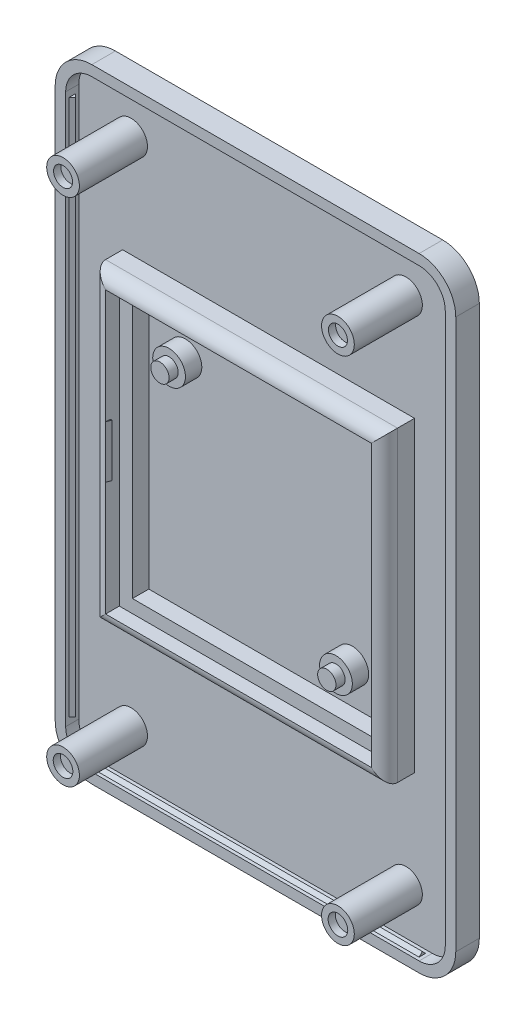
from build123d import *

# Parameters (mm, degrees)
ESQUISSE2_W              = 58
ESQUISSE2_H              = 92
BOSS_EXTRU_1_DEPTH       = 1.6
CONG_1_R                 = 4
ESQUISSE3_W              = 40.6
ESQUISSE3_H              = 42.9
ESQUISSE3_W_2            = 36.6
ESQUISSE3_H_2            = 38.9
EXTRU_MINCE1_DEPTH       = 2.5
ESQUISSE4_R              = 2.5
BOSS_EXTRU_2_DEPTH       = 2.5
ESQUISSE5_R              = 1.4
BOSS_EXTRU_3_DEPTH       = 3.9
ESQUISSE6_R              = 2.5
BOSS_EXTRU_4_DEPTH       = 2.5
ESQUISSE7_R              = 1.4
BOSS_EXTRU_5_DEPTH       = 3.9
ESQUISSE8_W              = 44.6
ESQUISSE8_H              = 46.9
ESQUISSE8_W_2            = 40.6
ESQUISSE8_H_2            = 42.9
EXTRU_MINCE2_DEPTH       = 4.6
CONG_2_R                 = 2
ESQUISSE10_R             = 2.5
BOSS_EXTRU_6_DEPTH       = 10.4
ESQUISSE13_R             = 1.5
ESQUISSE13_R_2           = 1.45
ENL_V_MAT_EXTRU_1_DEPTH  = 1.1
EXTRU_MINCE3_DEPTH       = 2
EXTRU_MINCE3_DEPTH_BACK  = 1.6
BOSS_EXTRU_9_DEPTH       = 4
BOSS_EXTRU_9_DEPTH_BACK  = 4
BOSS_EXTRU_10_DEPTH      = 4
BOSS_EXTRU_10_DEPTH_BACK = 4
BOSS_EXTRU_11_DEPTH      = 41
BOSS_EXTRU_12_DEPTH      = 24.5
ENL_V_MAT_EXTRU_4_DEPTH  = 0.6


with BuildPart() as part:
    # Esquisse2 → Boss.-Extru.1 (new body)
    with BuildSketch(Plane.XY):
        Rectangle(ESQUISSE2_W, ESQUISSE2_H)
    extrude(amount=-BOSS_EXTRU_1_DEPTH)

    # Congé1
    cong_1_edges = [part.edges().sort_by_distance(p)[0] for p in [
        (29, -46, -0.8),
        (-29, -46, -0.8),
        (-29, 46, -0.8),
        (29, 46, -0.8),
    ]]
    fillet(cong_1_edges, radius=CONG_1_R)

    # Esquisse3 → Extru.-Mince1 (add)
    with BuildSketch(Plane.XY):
        Rectangle(ESQUISSE3_W, ESQUISSE3_H)
        Rectangle(ESQUISSE3_W_2, ESQUISSE3_H_2, mode=Mode.SUBTRACT)
    extrude(amount=EXTRU_MINCE1_DEPTH)

    # Esquisse4 → Boss.-Extru.2 (add)
    with BuildSketch(Plane.XY):
        with Locations(Location((-12.7, 13.95, 0), (0, 0, 180))):
            Circle(ESQUISSE4_R)
    extrude(amount=BOSS_EXTRU_2_DEPTH)

    # Esquisse5 → Boss.-Extru.3 (add)
    with BuildSketch(Plane.XY):
        with Locations((-12.7, 13.95)):
            Circle(ESQUISSE5_R)
    extrude(amount=BOSS_EXTRU_3_DEPTH)

    # Esquisse6 → Boss.-Extru.4 (add)
    with BuildSketch(Plane.XY):
        with Locations(Location((12.8, -13.95, 0), (0, 0, 180))):
            Circle(ESQUISSE6_R)
    extrude(amount=BOSS_EXTRU_4_DEPTH)

    # Esquisse7 → Boss.-Extru.5 (add)
    with BuildSketch(Plane.XY):
        with Locations((12.8, -13.95)):
            Circle(ESQUISSE7_R)
    extrude(amount=BOSS_EXTRU_5_DEPTH)

    # Esquisse8 → Extru.-Mince2 (add)
    with BuildSketch(Plane.XY):
        Rectangle(ESQUISSE8_W, ESQUISSE8_H)
        Rectangle(ESQUISSE8_W_2, ESQUISSE8_H_2, mode=Mode.SUBTRACT)
    extrude(amount=EXTRU_MINCE2_DEPTH)

    # Congé2
    cong_2_edges = [part.edges().sort_by_distance(p)[0] for p in [
        (22.3, 0, 4.6),
        (0, 23.45, 4.6),
        (-22.3, 0, 4.6),
        (0, -23.45, 4.6),
    ]]
    fillet(cong_2_edges, radius=CONG_2_R - 0.0001)  # a hair under: the kernel refuses the full size

    # Esquisse10 → Boss.-Extru.6 (add)
    with BuildSketch(Plane.XY):
        with Locations(Location((21, -39, 0), (0, 0, 180))):
            Circle(ESQUISSE10_R)
        with Locations(Location((-21, -39, 0), (0, 0, 180))):
            Circle(ESQUISSE10_R)
        with Locations(Location((-21, 39, 0), (0, 0, 180))):
            Circle(ESQUISSE10_R)
        with Locations(Location((21, 39, 0), (0, 0, 180))):
            Circle(ESQUISSE10_R)
    extrude(amount=BOSS_EXTRU_6_DEPTH)

    # Esquisse13 → Enlèv. mat.-Extru.1 (cut)
    with BuildSketch(Plane.XY.offset(10.4)):
        with Locations((21, -39)):
            Circle(ESQUISSE13_R)
        with Locations((-21, -39)):
            Circle(ESQUISSE13_R)
        with Locations((-21, 39)):
            Circle(ESQUISSE13_R_2)
        with Locations((21, 39)):
            Circle(ESQUISSE13_R_2)
    extrude(amount=-ENL_V_MAT_EXTRU_1_DEPTH, mode=Mode.SUBTRACT)

    # Esquisse14 → Extru.-Mince3 (add, two sides: drawn at the far end of the back side and taken through both)
    with BuildSketch(Plane.XY.offset(-EXTRU_MINCE3_DEPTH_BACK)):
        with BuildLine():
            Line((-25, -47.6), (25, -47.6))
            ThreePointArc((25, -47.6), (28.959797975, -45.959797975), (30.6, -42))
            Line((30.6, -42), (30.6, 42))
            ThreePointArc((30.6, 42), (28.959797975, 45.959797975), (25, 47.6))
            Line((25, 47.6), (-25, 47.6))
            ThreePointArc((-25, 47.6), (-28.959797975, 45.959797975), (-30.6, 42))
            Line((-30.6, 42), (-30.6, -42))
            ThreePointArc((-30.6, -42), (-28.959797975, -45.959797975), (-25, -47.6))
        make_face()
        with BuildLine():
            Line((-25, -46), (25, -46))
            ThreePointArc((25, -46), (27.828427125, -44.828427125), (29, -42))
            Line((29, -42), (29, 42))
            ThreePointArc((29, 42), (27.828427125, 44.828427125), (25, 46))
            Line((25, 46), (-25, 46))
            ThreePointArc((-25, 46), (-27.828427125, 44.828427125), (-29, 42))
            Line((-29, 42), (-29, -42))
            ThreePointArc((-29, -42), (-27.828427125, -44.828427125), (-25, -46))
        make_face(mode=Mode.SUBTRACT)
    extrude(amount=EXTRU_MINCE3_DEPTH + EXTRU_MINCE3_DEPTH_BACK)

    # Esquisse3D7 → Boss.-Extru.9 (add, two sides: drawn at the far end of the back side and taken through both)
    with BuildSketch(Plane(origin=(20.3, 0, 4.6), x_dir=(-0.33633639699815254, -1.1714474630458867e-14, -0.9417419115948389), z_dir=(0, -1, 0)).offset(-BOSS_EXTRU_9_DEPTH_BACK)):
        Polygon((0, 0), (0.659219338, 0.235435478), (0.743303437, 0), align=None)
    extrude(amount=BOSS_EXTRU_9_DEPTH + BOSS_EXTRU_9_DEPTH_BACK)

    # Esquisse3D9 → Boss.-Extru.11 (add, symmetric)
    with BuildSketch(Plane(origin=(29, 0, 1), x_dir=(0, 0, -1), z_dir=(0, 1, 0))):
        Polygon((0, 0), (-0.5, 0), (0, 0.5), (0.5, 0), align=None)
    boss_extru_11 = extrude(amount=BOSS_EXTRU_11_DEPTH, both=True)

    # Symétrie1: Boss.-Extru.11 across plane
    add(boss_extru_11.mirror(Plane(origin=(0, 0, 0), x_dir=(0, 0, 1), z_dir=(1, 0, 0))))

    # Esquisse3D12 → Boss.-Extru.12 (add, symmetric)
    with BuildSketch(Plane(origin=(0, 46, 1.5), x_dir=(0, 0, -1), z_dir=(-1, 0, 0))):
        Polygon((0, 0), (0.5, 0.5), (1, 0), align=None)
    boss_extru_12 = extrude(amount=BOSS_EXTRU_12_DEPTH, both=True)

    # Symétrie2: Boss.-Extru.12 across plane
    add(boss_extru_12.mirror(Plane.ZX))

    # Esquisse31 → Enlèv. mat.-Extru.4 (cut)
    with BuildSketch(Plane(origin=(0, 0, -1.6), x_dir=(-1, 0, 0), z_dir=(0, 0, -1))):
        with BuildLine():
            add(Edge.make_bspline(
                [(4.349206349, -9.988662132), (3.968253968, -9.83446712), (3.696145125, -9.489795918), (3.632653061, -9.081632653)],
                knots=[0, 0, 0, 0, 1, 1, 1, 1], degree=3))
            add(Edge.make_bspline(
                [(3.632653061, -9.081632653), (3.587301587, -8.845804989), (3.632653061, -8.682539683), (3.995464853, -8.029478458)],
                knots=[1, 1, 1, 1, 2, 2, 2, 2], degree=3))
            add(Edge.make_bspline(
                [(3.995464853, -8.029478458), (5.35600907, -5.580498866), (6.054421769, -2.814058957), (6.01814059, -0.011337868)],
                knots=[2, 2, 2, 2, 3, 3, 3, 3], degree=3))
            add(Edge.make_bspline(
                [(6.01814059, -0.011337868), (6.054421769, 2.709750567), (5.392290249, 5.367346939), (4.0861678, 7.752834467)],
                knots=[3, 3, 3, 3, 4, 4, 4, 4], degree=3))
            add(Edge.make_bspline(
                [(4.0861678, 7.752834467), (3.89569161, 8.151927438), (3.723356009, 8.532879819), (3.578231293, 8.941043084)],
                knots=[4, 4, 4, 4, 5, 5, 5, 5], degree=3))
            add(Edge.make_bspline(
                [(3.578231293, 8.941043084), (3.632653061, 9.285714286), (3.804988662, 9.603174603), (4.0861678, 9.793650794)],
                knots=[5, 5, 5, 5, 6, 6, 6, 6], degree=3))
            add(Edge.make_bspline(
                [(4.0861678, 9.793650794), (4.494331066, 10.011337868), (4.993197279, 9.965986395), (5.365079365, 9.712018141)],
                knots=[6, 6, 6, 6, 7, 7, 7, 7], degree=3))
            add(Edge.make_bspline(
                [(5.365079365, 9.712018141), (5.619047619, 9.385487528), (5.836734694, 9.058956916), (6.01814059, 8.678004535)],
                knots=[7, 7, 7, 7, 8, 8, 8, 8], degree=3))
            add(Edge.make_bspline(
                [(6.01814059, 8.678004535), (6.997732426, 6.79138322), (7.659863946, 4.795918367), (7.986394558, 2.709750567)],
                knots=[8, 8, 8, 8, 9, 9, 9, 9], degree=3))
            add(Edge.make_bspline(
                [(7.986394558, 2.709750567), (8.195011338, 1.068027211), (8.222222222, -0.600907029), (8.068027211, -2.25170068)],
                knots=[9, 9, 9, 9, 10, 10, 10, 10], degree=3))
            add(Edge.make_bspline(
                [(8.068027211, -2.25170068), (7.786848073, -4.37414966), (7.160997732, -6.424036281), (6.199546485, -8.337868481)],
                knots=[10, 10, 10, 10, 11, 11, 11, 11], degree=3))
            add(Edge.make_bspline(
                [(6.199546485, -8.337868481), (5.619047619, -9.498866213), (5.292517007, -9.988662132), (4.947845805, -9.988662132)],
                knots=[11, 11, 11, 11, 12, 12, 12, 12], degree=3))
            add(Edge.make_bspline(
                [(4.947845805, -9.988662132), (4.875283447, -9.988662132), (4.793650794, -9.988662132), (4.721088435, -9.988662132)],
                knots=[12, 12, 12, 12, 13, 13, 13, 13], degree=3))
            add(Edge.make_bspline(
                [(4.721088435, -9.988662132), (4.594104308, -9.988662132), (4.476190476, -9.988662132), (4.349206349, -9.988662132)],
                knots=[13, 13, 13, 13, 14, 14, 14, 14], degree=3))
        make_face()
        with BuildLine():
            add(Edge.make_bspline(
                [(0.394557823, -7.93877551), (0.394557823, -7.953892668), (0.394557823, -7.969009826), (0.394557823, -7.984126984)],
                knots=[9, 9, 9, 9, 10, 10, 10, 10], degree=3))
            add(Edge.make_bspline(
                [(0.394557823, -7.984126984), (-0.12244898, -7.839002268), (-0.448979592, -7.31292517), (-0.340136054, -6.786848073)],
                knots=[0, 0, 0, 0, 1, 1, 1, 1], degree=3))
            add(Edge.make_bspline(
                [(-0.340136054, -6.786848073), (-0.340136054, -6.678004535), (-0.058956916, -6.179138322), (0.195011338, -5.671201814)],
                knots=[1, 1, 1, 1, 2, 2, 2, 2], degree=3))
            add(Edge.make_bspline(
                [(0.195011338, -5.671201814), (1.265306122, -3.612244898), (1.727891156, -1.290249433), (1.519274376, 1.022675737)],
                knots=[2, 2, 2, 2, 3, 3, 3, 3], degree=3))
            add(Edge.make_bspline(
                [(1.519274376, 1.022675737), (1.392290249, 2.682539683), (0.911564626, 4.297052154), (0.12244898, 5.757369615)],
                knots=[3, 3, 3, 3, 4, 4, 4, 4], degree=3))
            add(Edge.make_bspline(
                [(0.12244898, 5.757369615), (-0.448979592, 6.900226757), (-0.485260771, 7.081632653), (-0.149659864, 7.571428571)],
                knots=[4, 4, 4, 4, 5, 5, 5, 5], degree=3))
            add(Edge.make_bspline(
                [(-0.149659864, 7.571428571), (0.249433107, 8.015873016), (0.911564626, 8.079365079), (1.401360544, 7.698412698)],
                knots=[5, 5, 5, 5, 6, 6, 6, 6], degree=3))
            add(Edge.make_bspline(
                [(1.401360544, 7.698412698), (2.054421769, 6.736961451), (2.571428571, 5.684807256), (2.952380952, 4.578231293)],
                knots=[6, 6, 6, 6, 7, 7, 7, 7], degree=3))
            add(Edge.make_bspline(
                [(2.952380952, 4.578231293), (4.113378685, 1.140589569), (3.931972789, -2.605442177), (2.444444444, -5.907029478)],
                knots=[7, 7, 7, 7, 8, 8, 8, 8], degree=3))
            add(Edge.make_bspline(
                [(2.444444444, -5.907029478), (1.682539683, -7.621315193), (1.14739229, -8.174603175), (0.394557823, -7.93877551)],
                knots=[8, 8, 8, 8, 9, 9, 9, 9], degree=3))
        make_face()
        with BuildLine():
            add(Edge.make_bspline(
                [(-3.68707483, -5.907029478), (-3.68707483, -5.925170068), (-3.68707483, -5.943310658), (-3.68707483, -5.961451247)],
                knots=[10, 10, 10, 10, 11, 11, 11, 11], degree=3))
            add(Edge.make_bspline(
                [(-3.68707483, -5.961451247), (-4.013605442, -5.816326531), (-4.258503401, -5.526077098), (-4.349206349, -5.181405896)],
                knots=[0, 0, 0, 0, 1, 1, 1, 1], degree=3))
            add(Edge.make_bspline(
                [(-4.349206349, -5.181405896), (-4.349206349, -5), (-4.349206349, -4.764172336), (-3.941043084, -4.038548753)],
                knots=[1, 1, 1, 1, 2, 2, 2, 2], degree=3))
            add(Edge.make_bspline(
                [(-3.941043084, -4.038548753), (-2.589569161, -1.589569161), (-2.589569161, 1.385487528), (-3.941043084, 3.83446712)],
                knots=[2, 2, 2, 2, 3, 3, 3, 3], degree=3))
            add(Edge.make_bspline(
                [(-3.941043084, 3.83446712), (-4.530612245, 4.977324263), (-4.530612245, 5.213151927), (-4.049886621, 5.648526077)],
                knots=[3, 3, 3, 3, 4, 4, 4, 4], degree=3))
            add(Edge.make_bspline(
                [(-4.049886621, 5.648526077), (-3.87755102, 5.848072562), (-3.623582766, 5.947845805), (-3.351473923, 5.911564626)],
                knots=[4, 4, 4, 4, 5, 5, 5, 5], degree=3))
            add(Edge.make_bspline(
                [(-3.351473923, 5.911564626), (-2.770975057, 5.911564626), (-2.444444444, 5.630385488), (-1.954648526, 4.605442177)],
                knots=[5, 5, 5, 5, 6, 6, 6, 6], degree=3))
            add(Edge.make_bspline(
                [(-1.954648526, 4.605442177), (-1.183673469, 3.19047619), (-0.784580499, 1.603174603), (-0.793650794, -0.011337868)],
                knots=[6, 6, 6, 6, 7, 7, 7, 7], degree=3))
            add(Edge.make_bspline(
                [(-0.793650794, -0.011337868), (-0.757369615, -1.653061224), (-1.156462585, -3.285714286), (-1.945578231, -4.727891156)],
                knots=[7, 7, 7, 7, 8, 8, 8, 8], degree=3))
            add(Edge.make_bspline(
                [(-1.945578231, -4.727891156), (-2.43537415, -5.680272109), (-2.680272109, -5.907029478), (-3.170068027, -5.988662132)],
                knots=[8, 8, 8, 8, 9, 9, 9, 9], degree=3))
            add(Edge.make_bspline(
                [(-3.170068027, -5.988662132), (-3.342403628, -6.006802721), (-3.523809524, -5.988662132), (-3.68707483, -5.907029478)],
                knots=[9, 9, 9, 9, 10, 10, 10, 10], degree=3))
        make_face()
        with BuildLine():
            add(Edge.make_bspline(
                [(-7.496598639, -4.029478458), (-7.499622071, -4.029478458), (-7.502645503, -4.029478458), (-7.505668934, -4.029478458)],
                knots=[9, 9, 9, 9, 10, 10, 10, 10], degree=3))
            add(Edge.make_bspline(
                [(-7.505668934, -4.029478458), (-7.804988662, -3.884353741), (-8.040816327, -3.639455782), (-8.158730159, -3.321995465)],
                knots=[0, 0, 0, 0, 1, 1, 1, 1], degree=3))
            add(Edge.make_bspline(
                [(-8.158730159, -3.321995465), (-8.249433107, -3.004535147), (-8.158730159, -2.732426304), (-7.795918367, -2.151927438)],
                knots=[1, 1, 1, 1, 2, 2, 2, 2], degree=3))
            add(Edge.make_bspline(
                [(-7.795918367, -2.151927438), (-7.342403628, -1.535147392), (-7.124716553, -0.77324263), (-7.170068027, -0.011337868)],
                knots=[2, 2, 2, 2, 3, 3, 3, 3], degree=3))
            add(Edge.make_bspline(
                [(-7.170068027, -0.011337868), (-7.106575964, 0.759637188), (-7.315192744, 1.52154195), (-7.759637188, 2.156462585)],
                knots=[3, 3, 3, 3, 4, 4, 4, 4], degree=3))
            add(Edge.make_bspline(
                [(-7.759637188, 2.156462585), (-7.9138322, 2.383219955), (-8.040816327, 2.628117914), (-8.158730159, 2.873015873)],
                knots=[4, 4, 4, 4, 5, 5, 5, 5], degree=3))
            add(Edge.make_bspline(
                [(-8.158730159, 2.873015873), (-8.258503401, 3.444444444), (-7.87755102, 3.988662132), (-7.25170068, 4.097505669)],
                knots=[5, 5, 5, 5, 6, 6, 6, 6], degree=3))
            add(Edge.make_bspline(
                [(-7.25170068, 4.097505669), (-6.761904762, 4.188208617), (-6.41723356, 3.979591837), (-5.963718821, 3.290249433)],
                knots=[6, 6, 6, 6, 7, 7, 7, 7], degree=3))
            add(Edge.make_bspline(
                [(-5.963718821, 3.290249433), (-4.648526077, 1.285714286), (-4.648526077, -1.299319728), (-5.963718821, -3.303854875)],
                knots=[7, 7, 7, 7, 8, 8, 8, 8], degree=3))
            add(Edge.make_bspline(
                [(-5.963718821, -3.303854875), (-6.426303855, -4.002267574), (-6.952380952, -4.210884354), (-7.496598639, -4.029478458)],
                knots=[8, 8, 8, 8, 9, 9, 9, 9], degree=3))
        make_face()
    extrude(amount=-ENL_V_MAT_EXTRU_4_DEPTH, mode=Mode.SUBTRACT)


with BuildPart() as body_2:
    # Esquisse3D8 → Boss.-Extru.10 (new, two sides: drawn at the far end of the back side and taken through both)
    with BuildSketch(Plane(origin=(-20.3, 0, 4.6), x_dir=(0.39433589448719514, 0, -0.9189663771428114), z_dir=(0, 1, 0)).offset(-BOSS_EXTRU_10_DEPTH_BACK)):
        Polygon((0, 0), (0.745079558, 0), (0.672937939, 0.220333457), align=None)
    extrude(amount=BOSS_EXTRU_10_DEPTH + BOSS_EXTRU_10_DEPTH_BACK)


solid = Compound([part.part, body_2.part])
